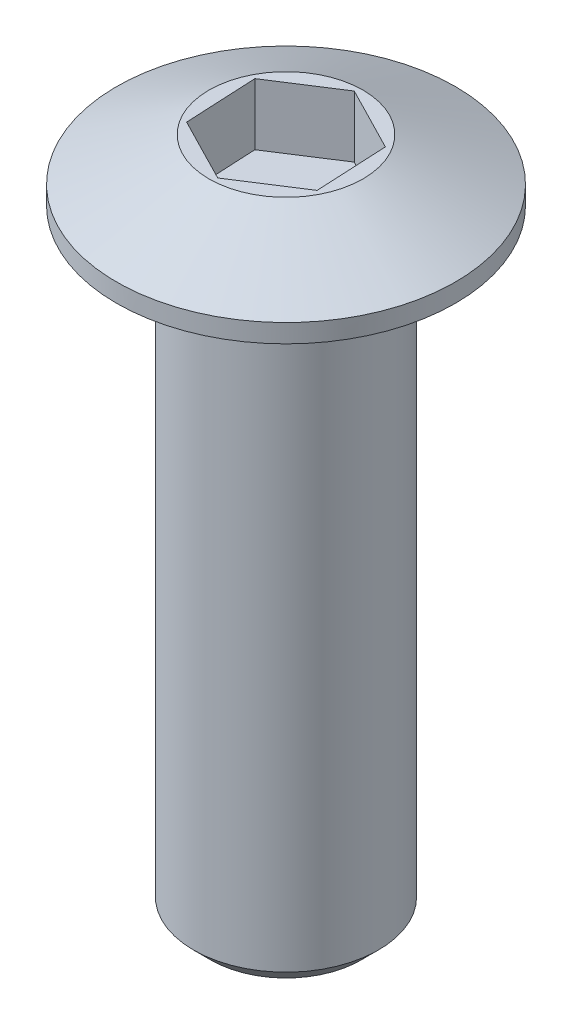
from build123d import *

# Parameters (mm, degrees)
SKETCH1_R           = 2.75
BOSS_EXTRUDE1_DEPTH = 0.3
SKETCH2_R           = 1.25
CUT_EXTRUDE1_DEPTH  = 1


# Read off the part's stored shape, not the designer's step: M3x0.5 Machine Threads Stud1
with BuildPart() as part:
    # Sketch1 → Boss-Extrude1 (new body)
    with BuildSketch(Plane(origin=(0, 0, 0), x_dir=(1, 0, 0), z_dir=(0, 1, 0))):
        with Locations(Location((0, 0, 0), (0, 0, 270))):
            Circle(SKETCH1_R)
    extrude(amount=BOSS_EXTRUDE1_DEPTH)

    # Sketch2 → section 0 of loft1
    with BuildSketch(Plane(origin=(0, 1, 0), x_dir=(1, 0, 0), z_dir=(0, 1, 0)), mode=Mode.PRIVATE) as loft1_s0:
        Circle(SKETCH2_R)
    # loft up to a face of the part (loft1)
    loft([loft1_s0.sketch, Face(Wire([part.edges().sort_by_distance((2.004663725, 0.3, -1.882504541))[0]]))])

    # Sketch2<4> → Cut-Extrude1 (cut)
    with BuildSketch(Plane(origin=(0, 1, 0), x_dir=(1, 0, 0), z_dir=(0, 1, 0))):
        Polygon((-0.98095369, -0.632504307), (0.057287953, -1.165782969), (1.038241642, -0.533278662), (0.98095369, 0.632504307), (-0.057287953, 1.165782969), (-1.038241642, 0.533278662), align=None)
    extrude(amount=-CUT_EXTRUDE1_DEPTH, mode=Mode.SUBTRACT)

    # M3x0.5 Machine Threads Stud1 outline → M3x0.5 Machine Threads Stud1 (revolve)
    with BuildSketch(Plane.XY):
        Polygon((0, 0), (0, -10), (1.2195, -10), (1.5, -9.7195), (1.5, 0), align=None)
    revolve(axis=Axis((0, 0, 0), (0, 1, 0)))


solid = part.part
